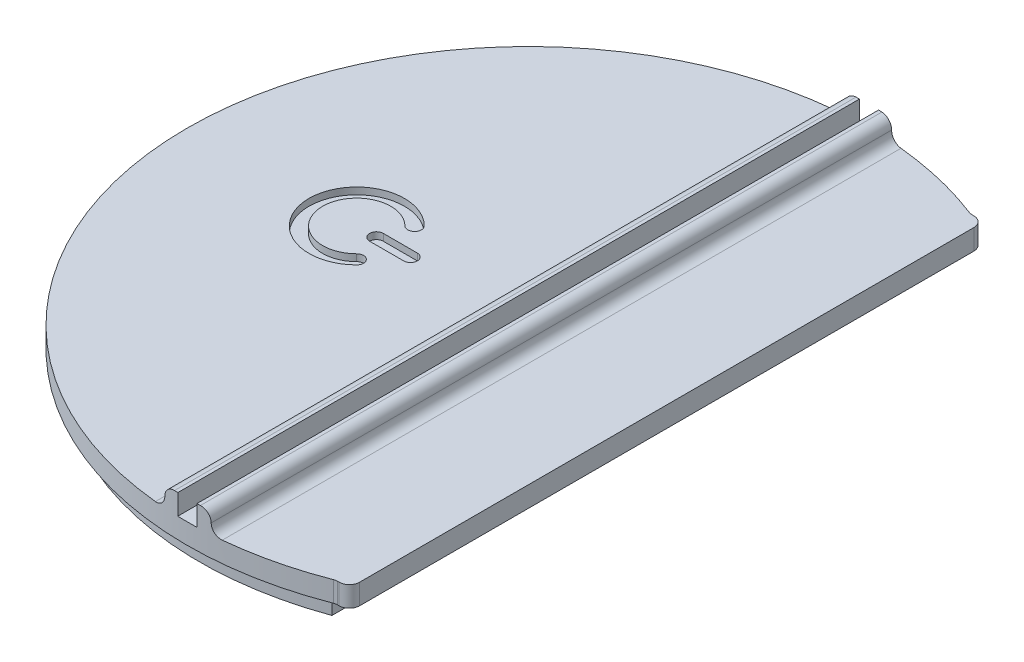
from build123d import *
from build123d.topology import SkipClean

# Parameters (mm, degrees)
BOSS_EXTRUDE1_DEPTH     = 3
CUT_EXTRUDE1_DEPTH      = 71.774289117
CUT_EXTRUDE1_DEPTH_BACK = 71.774289117
SKETCH2_W               = 2.8
SKETCH2_H               = 50
BOSS_EXTRUDE2_DEPTH     = 3
SKETCH4_W               = 2
SKETCH4_H               = 25
CUT_EXTRUDE2_DEPTH      = 3
BOSS_EXTRUDE3_DEPTH     = 3
SKETCH7_W               = 93.053616802
SKETCH7_H               = 3
BOSS_EXTRUDE4_DEPTH     = 2
CUT_EXTRUDE3_DEPTH      = 1
FILLET1_R               = 1.5


with BuildPart() as part:
    # Sketch1 → Boss-Extrude1 (new body)
    with BuildSketch(Plane(origin=(0, 0, 0), x_dir=(1, 0, 0), z_dir=(0, 1, 0))):
        with BuildLine():
            Line((18.31, 46.526808401), (18.31, -46.526808401))
            ThreePointArc((18.31, -46.526808401), (-50, 0), (18.31, 46.526808401))
        make_face()
    extrude(amount=BOSS_EXTRUDE1_DEPTH)

    # Sketch2 → Cut-Extrude1 (cut, two sides: drawn at the far end of the back side and taken through both)
    with BuildSketch(Plane(origin=(0, 3, 0), x_dir=(1, 0, 0), z_dir=(0, 1, 0)).offset(-CUT_EXTRUDE1_DEPTH_BACK)):
        Rectangle(SKETCH2_W, SKETCH2_H)
    extrude(amount=CUT_EXTRUDE1_DEPTH + CUT_EXTRUDE1_DEPTH_BACK, mode=Mode.SUBTRACT)

    # Sketch3 → Boss-Extrude2 (add)
    with BuildSketch(Plane.XZ):
        with BuildLine():
            Line((16.51, -45.284212481), (16.51, 45.284212481))
            ThreePointArc((16.51, 45.284212481), (-48.2, 0), (16.51, -45.284212481))
        make_face()
        with BuildLine():
            Line((14.51, -43.862283342), (14.51, 43.862283342))
            ThreePointArc((14.51, 43.862283342), (-46.2, 0), (14.51, -43.862283342))
        make_face(mode=Mode.SUBTRACT)
    extrude(amount=BOSS_EXTRUDE2_DEPTH)

    # Sketch4 → Cut-Extrude2 (cut)
    with BuildSketch(Plane.XZ.offset(3)):
        with Locations((15.51, -4.026808401)):
            Rectangle(SKETCH4_W, SKETCH4_H)
    extrude(amount=-CUT_EXTRUDE2_DEPTH, mode=Mode.SUBTRACT)

    # Sketch6 → Boss-Extrude3 (add)
    with SkipClean():  # the faces are left unmerged after this step: merging them gives an invalid solid
        with BuildSketch(Plane(origin=(0, 3, 0), x_dir=(1, 0, 0), z_dir=(0, 1, 0))):
            with BuildLine():
                Line((-1.4, 25), (-1.4, 49.980396157))
                ThreePointArc((-1.4, 49.980396157), (-2.400481254, 49.942343655), (-3.4, 49.884266057))
                Line((-3.4, 49.884266057), (-3.4, -49.884266057))
                ThreePointArc((-3.4, -49.884266057), (-2.400481254, -49.942343655), (-1.4, -49.980396157))
                Line((-1.4, -49.980396157), (-1.4, -25))
                Line((-1.4, -25), (-1.4, 25))
            make_face()
            with BuildLine():
                ThreePointArc((3.4, 49.884266057), (2.400481254, 49.942343655), (1.4, 49.980396157))
                Line((1.4, 49.980396157), (1.4, 25))
                Line((1.4, 25), (1.4, -25))
                Line((1.4, -25), (1.4, -49.980396157))
                ThreePointArc((1.4, -49.980396157), (2.400481254, -49.942343655), (3.4, -49.884266057))
                Line((3.4, -49.884266057), (3.4, 49.884266057))
            make_face()
        extrude(amount=BOSS_EXTRUDE3_DEPTH)

    # Sketch7 → Boss-Extrude4 (add)
    with SkipClean():  # the faces are left unmerged after this step: merging them gives an invalid solid
        with BuildSketch(Plane(origin=(18.31, 0, 0), x_dir=(0, 0, -1), z_dir=(1, 0, 0))):
            with Locations((0, 1.5)):
                Rectangle(SKETCH7_W, SKETCH7_H)
        extrude(amount=BOSS_EXTRUDE4_DEPTH)

    # Sketch8 → Cut-Extrude3 (cut)
    with SkipClean():  # the faces are left unmerged after this step: merging them gives an invalid solid
        with BuildSketch(Plane(origin=(0, 3, 0), x_dir=(1, 0, 0), z_dir=(0, 1, 0))):
            with BuildLine():
                Line((-17.253164172, 1), (-22.253164172, 1))
                ThreePointArc((-22.253164172, 1), (-23.253164172, 0), (-22.253164172, -1))
                Line((-22.253164172, -1), (-17.253164172, -1))
                ThreePointArc((-17.253164172, -1), (-16.253164172, 0), (-17.253164172, 1))
            make_face()
            with BuildLine():
                ThreePointArc((-20.190928157, 4.949747468), (-32.140675626, 0), (-20.190928157, -4.949747468))
                ThreePointArc((-20.190928157, -4.949747468), (-20.190928157, -3.535533906), (-21.60514172, -3.535533906))
                ThreePointArc((-21.60514172, -3.535533906), (-30.140675626, 0), (-21.60514172, 3.535533906))
                ThreePointArc((-21.60514172, 3.535533906), (-20.190928157, 3.535533906), (-20.190928157, 4.949747468))
            make_face()
        extrude(amount=-CUT_EXTRUDE3_DEPTH, mode=Mode.SUBTRACT)

    # Fillet1
    # the kernel refuses this fillet: 1.5 mm, written as the material it adds along each edge
    with BuildSketch(Plane(origin=(18.31, 0, -46.526808401), x_dir=(-0.9315513824511361, 0, -0.3636097108898181), z_dir=(0, 1, 0))) as fillet1_piece_1:
        with BuildLine():
            CenterArc((0.282386116, -1.499994195), FILLET1_R, 90.159404468, 21.162642488)
            Line((-0.26302845, -0.102667121), (0, 0))
            ThreePointArc((0, 0), (0.139106461, -0.000193506), (0.278212923, 0))
        make_face()
    extrude(amount=3)
    with BuildSketch(Plane(origin=(18.31, 0, 46.526808401), x_dir=(-0.9315513824511399, 0, 0.3636097108898083), z_dir=(0, 1, 0))) as fillet1_piece_2:
        with BuildLine():
            CenterArc((0.282386116, 1.499994195), FILLET1_R, 248.677953043, 21.162642488)
            Line((-0.26302845, 0.102667121), (0, 0))
            ThreePointArc((0, 0), (0.139106461, 0.000193506), (0.278212923, 0))
        make_face()
    extrude(amount=3)
    with BuildSketch(Plane(origin=(-3.4, 3, -53.634266057), x_dir=(-1, 0, 0), z_dir=(0, 0, 1))) as fillet1_piece_3_section:
        with BuildLine():
            CenterArc((FILLET1_R, -FILLET1_R), FILLET1_R, 90, 90)
            Line((0, -FILLET1_R), (0, 0))
            Line((0, 0), (FILLET1_R, 0))
        make_face()
    fillet1_piece_3 = extrude(amount=107.268532113, mode=Mode.PRIVATE)
    fillet1_piece_3 = fillet1_piece_3 & Plane(origin=(0, 3.339687762, 0), x_dir=(0.36619999999999997, 0, 0.9305361680235755), z_dir=(0, -1, 0)) * Cylinder(50, 221, mode=Mode.PRIVATE)
    add(fillet1_piece_3)
    with BuildSketch(Plane(origin=(3.4, 3, 53.634266057), x_dir=(1, 0, 0), z_dir=(0, 0, -1))) as fillet1_piece_4_section:
        with BuildLine():
            CenterArc((FILLET1_R, -FILLET1_R), FILLET1_R, 90, 90)
            Line((0, -FILLET1_R), (0, 0))
            Line((0, 0), (FILLET1_R, 0))
        make_face()
    fillet1_piece_4 = extrude(amount=107.268532113, mode=Mode.PRIVATE)
    fillet1_piece_4 = fillet1_piece_4 & Plane(origin=(0, 3.339687762, 0), x_dir=(0.36619999999999997, 0, 0.9305361680235755), z_dir=(0, -1, 0)) * Cylinder(50, 221, mode=Mode.PRIVATE)
    add(fillet1_piece_4)
    # the kernel refuses this fillet: 1.5 mm, written as the material it takes off along each edge
    with BuildSketch(Plane(origin=(-3.4, 6, -53.634266057), x_dir=(0, -1, 0), z_dir=(0, 0, 1)), Plane(origin=(3.4, 6, 53.634266057), x_dir=(0, -1, 0), z_dir=(0, 0, -1))) as fillet1_2_piece_1:
        with BuildLine():
            CenterArc((FILLET1_R, FILLET1_R), FILLET1_R, 180, 90)
            Line((0, FILLET1_R), (0, 0))
            Line((0, 0), (FILLET1_R, 0))
        make_face()
    extrude(amount=107.268532113, mode=Mode.SUBTRACT)
    with BuildSketch(Plane(origin=(20.31, -3.75, 46.526808401), x_dir=(-1, 0, 0), z_dir=(0, 1, 0)), Plane(origin=(20.31, 6.75, -46.526808401), x_dir=(-1, 0, 0), z_dir=(0, -1, 0))) as fillet1_2_piece_2:
        with BuildLine():
            CenterArc((FILLET1_R, -FILLET1_R), FILLET1_R, 90, 90)
            Line((0, -FILLET1_R), (0, 0))
            Line((0, 0), (FILLET1_R, 0))
        make_face()
    extrude(amount=10.5, mode=Mode.SUBTRACT)


solid = part.part
